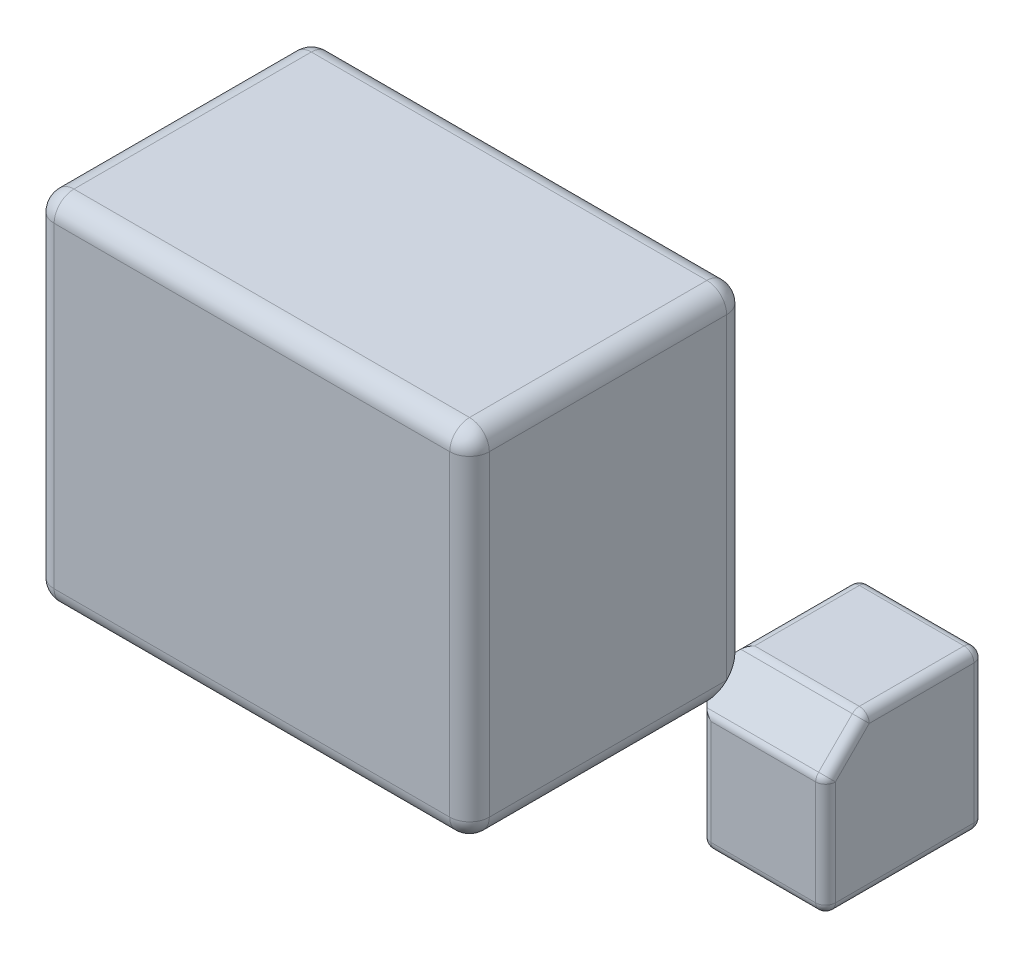
from build123d import *

# Parameters (mm, degrees)
SKETCH1_W                = 22
SKETCH1_H                = 18
BOSS_EXTRUDE1_DEPTH      = 14
SHELL1_T                 = 1
BOSS_EXTRUDE3_DEPTH      = 6
BOSS_EXTRUDE3_DEPTH_BACK = 2
SKETCH2_W                = 8
SKETCH2_H                = 8
CHAMFER2_SIZE            = 2
FILLET1_R                = 1
FILLET2_R                = 0.5


with BuildPart() as part:
    # Sketch1 → Boss-Extrude1 (new body)
    with BuildSketch(Plane.XY):
        with Locations((11, 9)):
            Rectangle(SKETCH1_W, SKETCH1_H)
    extrude(amount=BOSS_EXTRUDE1_DEPTH)

    # Shell1 (no face opened: a closed hollow body)
    add(offset(amount=-SHELL1_T, mode=Mode.PRIVATE), mode=Mode.SUBTRACT)

    # Sketch2 → Boss-Extrude3 (add, two sides: drawn at the far end of the back side and taken through both)
    with BuildSketch(Plane(origin=(0, 0, 0), x_dir=(-1, 0, 0), z_dir=(0, 0, -1)).offset(-BOSS_EXTRUDE3_DEPTH_BACK)):
        with Locations((-24, -2)):
            Rectangle(SKETCH2_W, SKETCH2_H)
    extrude(amount=BOSS_EXTRUDE3_DEPTH + BOSS_EXTRUDE3_DEPTH_BACK)

    # Chamfer2
    chamfer2_edges = [part.edges().sort_by_distance(p)[0] for p in [
        (20, -3, 2),
        (20, 2, -3),
        (25, 2, 2),
    ]]
    chamfer(chamfer2_edges, length=CHAMFER2_SIZE)

    # Fillet1
    # the kernel refuses this fillet: 1 mm, written as the material it takes off along each edge
    with BuildSketch(Plane(origin=(1, 17, 1), x_dir=(0, 1, 0), z_dir=(0, 0, -1))) as fillet1_piece_1_section:
        Polygon((0, 0), (FILLET1_R, 0), (FILLET1_R, -FILLET1_R), (0, -FILLET1_R), align=None)
    fillet1_piece_1 = extrude(amount=FILLET1_R, mode=Mode.PRIVATE)
    fillet1_piece_1 = fillet1_piece_1 - Plane(origin=(1, 17, 1), x_dir=(0.7071067811865476, -0.7071067811865474, 0), z_dir=(0, 0, -1)) * Sphere(FILLET1_R, mode=Mode.PRIVATE)
    add(fillet1_piece_1, mode=Mode.SUBTRACT)
    with BuildSketch(Plane(origin=(1, 1, 1), x_dir=(0, 0, -1), z_dir=(0, -1, 0))) as fillet1_piece_2_section:
        Polygon((0, 0), (FILLET1_R, 0), (FILLET1_R, -FILLET1_R), (0, -FILLET1_R), align=None)
    fillet1_piece_2 = extrude(amount=FILLET1_R, mode=Mode.PRIVATE)
    fillet1_piece_2 = fillet1_piece_2 - Plane(origin=(1, 1, 1), x_dir=(0.7071067811865475, 0, 0.7071067811865475), z_dir=(0, -1, 0)) * Sphere(FILLET1_R, mode=Mode.PRIVATE)
    add(fillet1_piece_2, mode=Mode.SUBTRACT)
    with BuildSketch(Plane(origin=(21, 17, 1), x_dir=(0, 0, -1), z_dir=(0, 1, 0))) as fillet1_piece_3_section:
        Polygon((0, 0), (FILLET1_R, 0), (FILLET1_R, -FILLET1_R), (0, -FILLET1_R), align=None)
    fillet1_piece_3 = extrude(amount=FILLET1_R, mode=Mode.PRIVATE)
    fillet1_piece_3 = fillet1_piece_3 - Plane(origin=(21, 17, 1), x_dir=(-0.7071067811865475, 0, 0.7071067811865475), z_dir=(0, 1, 0)) * Sphere(FILLET1_R, mode=Mode.PRIVATE)
    add(fillet1_piece_3, mode=Mode.SUBTRACT)
    with BuildSketch(Plane(origin=(1, 1, 13), x_dir=(-1, 0, 0), z_dir=(0, -1, 0))) as fillet1_piece_4_section:
        Polygon((0, 0), (FILLET1_R, 0), (FILLET1_R, -FILLET1_R), (0, -FILLET1_R), align=None)
    fillet1_piece_4 = extrude(amount=FILLET1_R, mode=Mode.PRIVATE)
    fillet1_piece_4 = fillet1_piece_4 - Plane(origin=(1, 1, 13), x_dir=(0.7071067811865475, 0, -0.7071067811865475), z_dir=(0, -1, 0)) * Sphere(FILLET1_R, mode=Mode.PRIVATE)
    add(fillet1_piece_4, mode=Mode.SUBTRACT)
    with BuildSketch(Plane(origin=(21, 1, 13), x_dir=(1, 0, 0), z_dir=(0, -1, 0))) as fillet1_piece_5_section:
        Polygon((0, 0), (FILLET1_R, 0), (FILLET1_R, FILLET1_R), (0, FILLET1_R), align=None)
    fillet1_piece_5 = extrude(amount=FILLET1_R, mode=Mode.PRIVATE)
    fillet1_piece_5 = fillet1_piece_5 - Plane(origin=(21, 1, 13), x_dir=(-0.7071067811865475, 0, -0.7071067811865475), z_dir=(0, -1, 0)) * Sphere(FILLET1_R, mode=Mode.PRIVATE)
    add(fillet1_piece_5, mode=Mode.SUBTRACT)
    with BuildSketch(Plane(origin=(21, 17, 13), x_dir=(1, 0, 0), z_dir=(0, 1, 0))) as fillet1_piece_6_section:
        Polygon((0, 0), (FILLET1_R, 0), (FILLET1_R, -FILLET1_R), (0, -FILLET1_R), align=None)
    fillet1_piece_6 = extrude(amount=FILLET1_R, mode=Mode.PRIVATE)
    fillet1_piece_6 = fillet1_piece_6 - Plane(origin=(21, 17, 13), x_dir=(-0.7071067811865475, 0, -0.7071067811865475), z_dir=(0, 1, 0)) * Sphere(FILLET1_R, mode=Mode.PRIVATE)
    add(fillet1_piece_6, mode=Mode.SUBTRACT)
    with BuildSketch(Plane(origin=(1, 17, 13), x_dir=(-1, 0, 0), z_dir=(0, 1, 0))) as fillet1_piece_7_section:
        Polygon((0, 0), (FILLET1_R, 0), (FILLET1_R, FILLET1_R), (0, FILLET1_R), align=None)
    fillet1_piece_7 = extrude(amount=FILLET1_R, mode=Mode.PRIVATE)
    fillet1_piece_7 = fillet1_piece_7 - Plane(origin=(1, 17, 13), x_dir=(0.7071067811865475, 0, -0.7071067811865475), z_dir=(0, 1, 0)) * Sphere(FILLET1_R, mode=Mode.PRIVATE)
    add(fillet1_piece_7, mode=Mode.SUBTRACT)
    with BuildSketch(Plane(origin=(0, 17, 0), x_dir=(1, 0, 0), z_dir=(0, -1, 0)), Plane(origin=(22, 1, 14), x_dir=(0, 0, -1), z_dir=(0, 1, 0)), Plane(origin=(0, 17, 14), x_dir=(0, 0, -1), z_dir=(0, -1, 0))) as fillet1_piece_8:
        with BuildLine():
            CenterArc((FILLET1_R, FILLET1_R), FILLET1_R, 180, 90)
            Line((0, FILLET1_R), (0, 0))
            Line((0, 0), (FILLET1_R, 0))
        make_face()
    extrude(amount=16, mode=Mode.SUBTRACT)
    with BuildSketch(Plane(origin=(1, 0, 0), x_dir=(0, 0, 1), z_dir=(1, 0, 0))) as fillet1_piece_9_section:
        with BuildLine():
            CenterArc((FILLET1_R, -FILLET1_R), FILLET1_R, 90, 90)
            Line((0, -FILLET1_R), (0, 0))
            Line((0, 0), (FILLET1_R, 0))
        make_face()
    fillet1_piece_9 = extrude(amount=21.5, mode=Mode.PRIVATE)
    fillet1_piece_9 = split(fillet1_piece_9, bisect_by=Plane(origin=(15.381840504, 0.226418621, -4.618159496), z_dir=(-0.7071067811865476, 0, 0.7071067811865476)), keep=Keep.TOP, mode=Mode.PRIVATE)
    fillet1_piece_9 = split(fillet1_piece_9, bisect_by=Plane(origin=(15.381840504, -4.618159496, 0.226418621), z_dir=(-0.7071067811865476, 0.7071067811865476, 0)), keep=Keep.TOP, mode=Mode.PRIVATE)
    add(fillet1_piece_9, mode=Mode.SUBTRACT)
    with BuildSketch(Plane(origin=(1, 0, 0), x_dir=(0, 0, 1), z_dir=(1, 0, 0))) as fillet1_piece_10_section:
        with BuildLine():
            CenterArc((FILLET1_R, -FILLET1_R), FILLET1_R, 90, 90)
            Line((0, -FILLET1_R), (0, 0))
            Line((0, 0), (FILLET1_R, 0))
        make_face()
    fillet1_piece_10 = extrude(amount=21.5, mode=Mode.PRIVATE)
    fillet1_piece_10 = split(fillet1_piece_10, bisect_by=Plane(origin=(20.16446835, 0.528927527, 0.16446835), z_dir=(0.7071067811865476, 0, -0.7071067811865476)), keep=Keep.TOP, mode=Mode.PRIVATE)
    fillet1_piece_10 = split(fillet1_piece_10, bisect_by=Plane(origin=(20.407441135, 0.407441135, 0.042981958), z_dir=(-0.7071067811865476, 0.7071067811865476, 0)), keep=Keep.TOP, mode=Mode.PRIVATE)
    add(fillet1_piece_10, mode=Mode.SUBTRACT)
    with BuildSketch(Plane(origin=(1, 0, 0), x_dir=(0, 0, 1), z_dir=(1, 0, 0))) as fillet1_piece_11_section:
        with BuildLine():
            CenterArc((FILLET1_R, -FILLET1_R), FILLET1_R, 90, 90)
            Line((0, -FILLET1_R), (0, 0))
            Line((0, 0), (FILLET1_R, 0))
        make_face()
    fillet1_piece_11 = extrude(amount=21.5, mode=Mode.PRIVATE)
    fillet1_piece_11 = split(fillet1_piece_11, bisect_by=Plane(origin=(20.407441135, 0.042981958, 0.407441135), z_dir=(-0.7071067811865476, 0, 0.7071067811865476)), keep=Keep.TOP, mode=Mode.PRIVATE)
    fillet1_piece_11 = split(fillet1_piece_11, bisect_by=Plane(origin=(20.16446835, 0.16446835, 0.528927527), z_dir=(0.7071067811865476, -0.7071067811865476, 0)), keep=Keep.TOP, mode=Mode.PRIVATE)
    add(fillet1_piece_11, mode=Mode.SUBTRACT)
    with BuildSketch(Plane(origin=(22, -0.5, 0), x_dir=(-1, 0, 0), z_dir=(0, 1, 0))) as fillet1_piece_12_section:
        with BuildLine():
            CenterArc((FILLET1_R, FILLET1_R), FILLET1_R, 180, 90)
            Line((0, FILLET1_R), (0, 0))
            Line((0, 0), (FILLET1_R, 0))
        make_face()
    fillet1_piece_12 = extrude(amount=17.5, mode=Mode.PRIVATE)
    fillet1_piece_12 = split(fillet1_piece_12, bisect_by=Plane(origin=(21.83553165, 1.83553165, 0.528927527), z_dir=(0.7071067811865476, -0.7071067811865476, 0)), keep=Keep.TOP, mode=Mode.PRIVATE)
    fillet1_piece_12 = split(fillet1_piece_12, bisect_by=Plane(origin=(21.957018042, 1.592558865, 0.407441135), z_dir=(0, 0.7071067811865476, 0.7071067811865476)), keep=Keep.TOP, mode=Mode.PRIVATE)
    add(fillet1_piece_12, mode=Mode.SUBTRACT)
    with BuildSketch(Plane(origin=(22, -0.5, 0), x_dir=(-1, 0, 0), z_dir=(0, 1, 0))) as fillet1_piece_13_section:
        with BuildLine():
            CenterArc((FILLET1_R, FILLET1_R), FILLET1_R, 180, 90)
            Line((0, FILLET1_R), (0, 0))
            Line((0, 0), (FILLET1_R, 0))
        make_face()
    fillet1_piece_13 = extrude(amount=17.5, mode=Mode.PRIVATE)
    fillet1_piece_13 = split(fillet1_piece_13, bisect_by=Plane(origin=(21.592558865, 1.592558865, 0.042981958), z_dir=(-0.7071067811865476, 0.7071067811865476, 0)), keep=Keep.TOP, mode=Mode.PRIVATE)
    fillet1_piece_13 = split(fillet1_piece_13, bisect_by=Plane(origin=(21.471072473, 1.83553165, 0.16446835), z_dir=(0, -0.7071067811865476, -0.7071067811865476)), keep=Keep.TOP, mode=Mode.PRIVATE)
    add(fillet1_piece_13, mode=Mode.SUBTRACT)
    with BuildSketch(Plane(origin=(22, -0.5, 0), x_dir=(-1, 0, 0), z_dir=(0, 1, 0))) as fillet1_piece_14_section:
        with BuildLine():
            CenterArc((FILLET1_R, FILLET1_R), FILLET1_R, 180, 90)
            Line((0, FILLET1_R), (0, 0))
            Line((0, 0), (FILLET1_R, 0))
        make_face()
    fillet1_piece_14 = extrude(amount=17.5, mode=Mode.PRIVATE)
    fillet1_piece_14 = split(fillet1_piece_14, bisect_by=Plane(origin=(25.618138272, 5.618138272, 0.226424858), z_dir=(-0.7071067811865476, 0.7071067811865476, 0)), keep=Keep.TOP, mode=Mode.PRIVATE)
    fillet1_piece_14 = split(fillet1_piece_14, bisect_by=Plane(origin=(21.773575142, 5.618138272, -3.618138272), z_dir=(0, 0.7071067811865476, 0.7071067811865476)), keep=Keep.TOP, mode=Mode.PRIVATE)
    add(fillet1_piece_14, mode=Mode.SUBTRACT)
    with BuildSketch(Plane(origin=(21, 18, 0), x_dir=(0, -1, 0), z_dir=(-1, 0, 0)), Plane(origin=(1, 0, 14), x_dir=(0, 0, -1), z_dir=(1, 0, 0))) as fillet1_piece_15:
        with BuildLine():
            CenterArc((FILLET1_R, FILLET1_R), FILLET1_R, 180, 90)
            Line((0, FILLET1_R), (0, 0))
            Line((0, 0), (FILLET1_R, 0))
        make_face()
    extrude(amount=20, mode=Mode.SUBTRACT)
    with BuildSketch(Plane(origin=(21, 18, 14), x_dir=(0, -1, 0), z_dir=(-1, 0, 0))) as fillet1_piece_16:
        with BuildLine():
            CenterArc((FILLET1_R, -FILLET1_R), FILLET1_R, 90, 90)
            Line((0, -FILLET1_R), (0, 0))
            Line((0, 0), (FILLET1_R, 0))
        make_face()
    extrude(amount=20, mode=Mode.SUBTRACT)
    with BuildSketch(Plane(origin=(0, 18, 1), x_dir=(0, -1, 0), z_dir=(0, 0, 1)), Plane(origin=(0, 0, 1), x_dir=(1, 0, 0), z_dir=(0, 0, 1))) as fillet1_piece_17:
        with BuildLine():
            CenterArc((FILLET1_R, FILLET1_R), FILLET1_R, 180, 90)
            Line((0, FILLET1_R), (0, 0))
            Line((0, 0), (FILLET1_R, 0))
        make_face()
    extrude(amount=12, mode=Mode.SUBTRACT)
    with BuildSketch(Plane(origin=(22, 18, 1), x_dir=(0, -1, 0), z_dir=(0, 0, 1))) as fillet1_piece_18:
        with BuildLine():
            CenterArc((FILLET1_R, -FILLET1_R), FILLET1_R, 90, 90)
            Line((0, -FILLET1_R), (0, 0))
            Line((0, 0), (FILLET1_R, 0))
        make_face()
    extrude(amount=12, mode=Mode.SUBTRACT)
    with BuildSketch(Plane(origin=(22, 0, -0.5), x_dir=(-1, 0, 0), z_dir=(0, 0, 1))) as fillet1_piece_19_section:
        with BuildLine():
            CenterArc((FILLET1_R, -FILLET1_R), FILLET1_R, 90, 90)
            Line((0, -FILLET1_R), (0, 0))
            Line((0, 0), (FILLET1_R, 0))
        make_face()
    fillet1_piece_19 = extrude(amount=13.5, mode=Mode.PRIVATE)
    fillet1_piece_19 = split(fillet1_piece_19, bisect_by=Plane(origin=(21.83553165, 0.528927527, 1.83553165), z_dir=(0.7071067811865476, 0, -0.7071067811865476)), keep=Keep.TOP, mode=Mode.PRIVATE)
    fillet1_piece_19 = split(fillet1_piece_19, bisect_by=Plane(origin=(21.957018042, 0.407441135, 1.592558865), z_dir=(0, 0.7071067811865476, 0.7071067811865476)), keep=Keep.TOP, mode=Mode.PRIVATE)
    add(fillet1_piece_19, mode=Mode.SUBTRACT)
    with BuildSketch(Plane(origin=(22, 0, -0.5), x_dir=(-1, 0, 0), z_dir=(0, 0, 1))) as fillet1_piece_20_section:
        with BuildLine():
            CenterArc((FILLET1_R, -FILLET1_R), FILLET1_R, 90, 90)
            Line((0, -FILLET1_R), (0, 0))
            Line((0, 0), (FILLET1_R, 0))
        make_face()
    fillet1_piece_20 = extrude(amount=13.5, mode=Mode.PRIVATE)
    fillet1_piece_20 = split(fillet1_piece_20, bisect_by=Plane(origin=(21.592558865, 0.042981958, 1.592558865), z_dir=(-0.7071067811865476, 0, 0.7071067811865476)), keep=Keep.TOP, mode=Mode.PRIVATE)
    fillet1_piece_20 = split(fillet1_piece_20, bisect_by=Plane(origin=(21.471072473, 0.16446835, 1.83553165), z_dir=(0, -0.7071067811865476, -0.7071067811865476)), keep=Keep.TOP, mode=Mode.PRIVATE)
    add(fillet1_piece_20, mode=Mode.SUBTRACT)
    with BuildSketch(Plane(origin=(22, 0, -0.5), x_dir=(-1, 0, 0), z_dir=(0, 0, 1))) as fillet1_piece_21_section:
        with BuildLine():
            CenterArc((FILLET1_R, -FILLET1_R), FILLET1_R, 90, 90)
            Line((0, -FILLET1_R), (0, 0))
            Line((0, 0), (FILLET1_R, 0))
        make_face()
    fillet1_piece_21 = extrude(amount=13.5, mode=Mode.PRIVATE)
    fillet1_piece_21 = split(fillet1_piece_21, bisect_by=Plane(origin=(24.618101716, 0.226435602, 4.618101716), z_dir=(-0.7071067811865476, 0, 0.7071067811865476)), keep=Keep.TOP, mode=Mode.PRIVATE)
    fillet1_piece_21 = split(fillet1_piece_21, bisect_by=Plane(origin=(21.773564398, -2.618101716, 4.618101716), z_dir=(0, 0.7071067811865476, 0.7071067811865476)), keep=Keep.TOP, mode=Mode.PRIVATE)
    add(fillet1_piece_21, mode=Mode.SUBTRACT)

    # Fillet2
    fillet2_edges = [part.edges().sort_by_distance(p)[0] for p in [
        (24, -6, -6),
        (28, -6, -2),
        (28, -2, -6),
        (28, 2, -3),
        (25, 2, -6),
        (22, 2, -3),
        (25, 2, 0),
        (28, -3, 2),
        (28, 1, 1),
        (25, -6, 2),
        (22, -3, 2),
        (25, 0, 2),
        (20, -3, -6),
        (20, -6, -3),
        (20, -3, 0),
        (20, 0, -3),
        (21, 1, -6),
        (21, -6, 1),
    ]]
    fillet(fillet2_edges, radius=FILLET2_R)


solid = part.part
